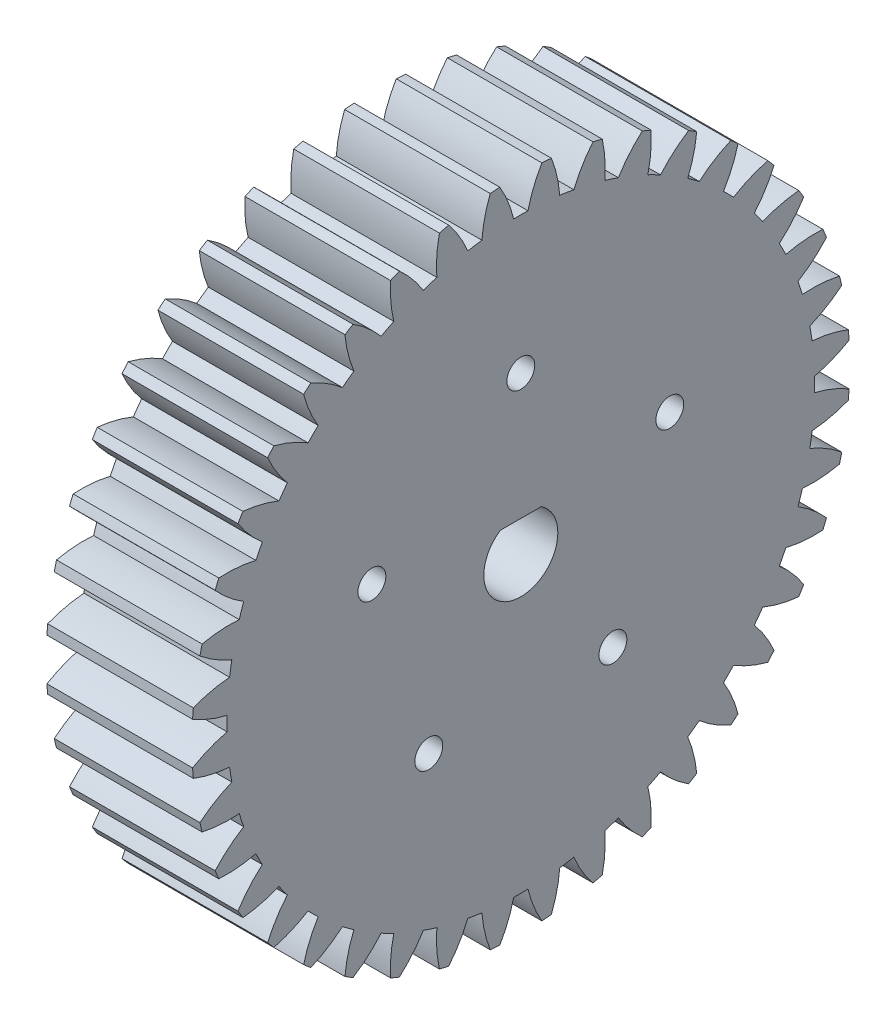
from build123d import *

# Parameters (mm, degrees)
BASPROSKE_W        = 11.811
BASPROSKE_H        = 26.67
TOOTHCUT_DEPTH     = 40.523126407
TEETHCUTS_COUNT    = 40
TEETHCUTS_ANGLE    = 351
BORSKE_R           = 0.396875
BORE_DEPTH         = 50.8000508
SKETCH3_R          = 1.1303
CUT_EXTRUDE1_DEPTH = 15.748


with BuildPart() as part:
    # BasProSke → Base-Revolve (revolve)
    with BuildSketch(Plane(origin=(0, 0, 0), x_dir=(1, 0, 0), z_dir=(0, 1, 0))):
        with Locations((5.9055, 13.335)):
            Rectangle(BASPROSKE_W, BASPROSKE_H)
    revolve(axis=Axis((-10, 0, 0), (1, 0, 0)))

    # TooCutSke → ToothCut (cut, through all)
    with BuildSketch(Plane(origin=(0, 0, 0), x_dir=(0, 0, -1), z_dir=(1, 0, 0))):
        with BuildLine():
            ThreePointArc((0.577296327, 23.818204886), (0, 23.8252), (-0.577296327, 23.818204886))
            ThreePointArc((-0.577296327, 23.818204886), (-1.042980967, 25.272123589), (-1.721261603, 26.639850594))
            ThreePointArc((-1.721261603, 26.639850594), (0, 26.6954), (1.721261603, 26.639850594))
            ThreePointArc((1.721261603, 26.639850594), (1.042980967, 25.272123589), (0.577296327, 23.818204886))
        make_face()
    toothcut = extrude(amount=TOOTHCUT_DEPTH, mode=Mode.SUBTRACT)

    # TeethCuts: ToothCut ×40 about axis
    teethcuts_axis = Axis((-10, 0, 0), (1, 0, 0))
    for i in range(1, TEETHCUTS_COUNT):
        add(toothcut.rotate(teethcuts_axis, i * TEETHCUTS_ANGLE / (TEETHCUTS_COUNT - 1)), mode=Mode.SUBTRACT)

    # BorSke → Bore (cut, symmetric)
    with BuildSketch(Plane(origin=(0, 0, 0), x_dir=(0, 0, -1), z_dir=(1, 0, 0))):
        Circle(BORSKE_R)
    extrude(amount=BORE_DEPTH, both=True, mode=Mode.SUBTRACT)

    # Sketch3 → Cut-Extrude1 (cut)
    with BuildSketch(Plane(origin=(11.811, 0, 0), x_dir=(0, 0, -1), z_dir=(1, 0, 0))):
        with Locations((0, 12.7)):
            Circle(SKETCH3_R)
        with Locations((12.078417757, 3.924515829)):
            Circle(SKETCH3_R)
        with Locations((7.464872704, -10.274515829)):
            Circle(SKETCH3_R)
        with Locations((-7.464872704, -10.274515829)):
            Circle(SKETCH3_R)
        with Locations((-12.078417757, 3.924515829)):
            Circle(SKETCH3_R)
        with BuildLine():
            Line((-1.658312395, 2.5), (1.658312395, 2.5))
            ThreePointArc((1.658312395, 2.5), (0, -3), (-1.658312395, 2.5))
        make_face()
    extrude(amount=-CUT_EXTRUDE1_DEPTH, mode=Mode.SUBTRACT)


solid = part.part
